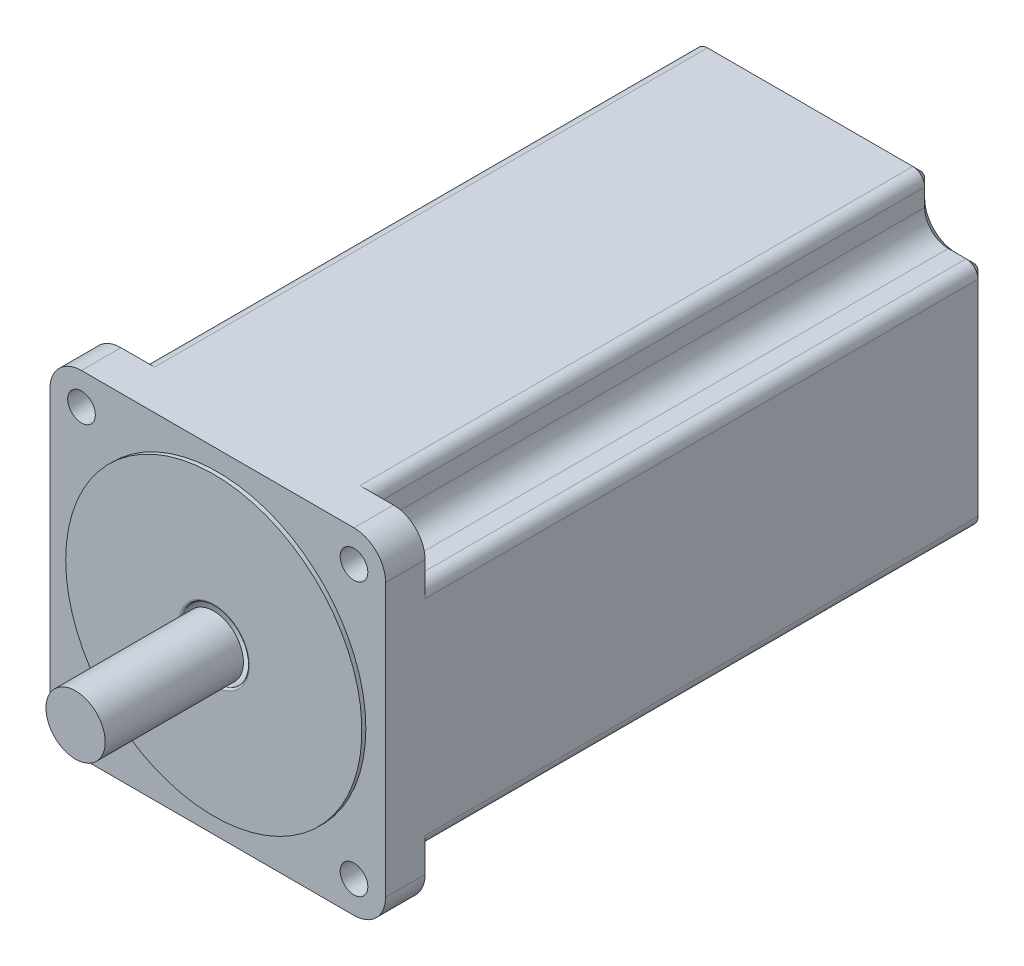
from build123d import *

# Parameters (mm, degrees)
SKETCH1_W                      = 152
SKETCH1_H                      = 85
BOSS_EXTRUDE1_DEPTH            = 85
SKETCH2_W                      = 13.5
SKETCH2_H                      = 13.5
CUT_EXTRUDE1_DEPTH             = 142
SKETCH3_W                      = 13.5
SKETCH3_H                      = 13.5
CUT_EXTRUDE2_DEPTH             = 142
SKETCH4_W                      = 13.5
SKETCH4_H                      = 13.5
CUT_EXTRUDE3_DEPTH             = 142
SKETCH5_W                      = 13.5
SKETCH5_H                      = 13.5
CUT_EXTRUDE4_DEPTH             = 142
SKETCH6_W                      = 37.5
SKETCH6_H                      = 1
F_7_0_7_DIAMETER_HOLE1_D       = 7
F_7_0_7_DIAMETER_HOLE1_DEPTH   = 152
F_17_0_17_DIAMETER_HOLE1_D     = 17
F_17_0_17_DIAMETER_HOLE1_DEPTH = 140
FILLET1_R                      = 3
FILLET2_R                      = 6
CHAMFER1_SIZE                  = 2
FILLET3_R                      = 0.5
FILLET4_R                      = 8
SKETCH11_R                     = 7.5
BOSS_EXTRUDE2_DEPTH            = 35


with BuildPart() as part:
    # Sketch1 → Boss-Extrude1 (new body)
    with BuildSketch(Plane(origin=(42.5, 0, 0), x_dir=(0, 0, -1), z_dir=(1, 0, 0))):
        with Locations((-76, 0)):
            Rectangle(SKETCH1_W, SKETCH1_H)
    extrude(amount=-BOSS_EXTRUDE1_DEPTH)

    # Sketch2 → Cut-Extrude1 (cut)
    with BuildSketch(Plane(origin=(0, 0, 0), x_dir=(-1, 0, 0), z_dir=(0, 0, -1))):
        with Locations((-35.75, -35.75)):
            Rectangle(SKETCH2_W, SKETCH2_H)
    extrude(amount=-CUT_EXTRUDE1_DEPTH, mode=Mode.SUBTRACT)

    # Sketch3 → Cut-Extrude2 (cut)
    with BuildSketch(Plane(origin=(0, 0, 0), x_dir=(-1, 0, 0), z_dir=(0, 0, -1))):
        with Locations((35.75, -35.75)):
            Rectangle(SKETCH3_W, SKETCH3_H)
    extrude(amount=-CUT_EXTRUDE2_DEPTH, mode=Mode.SUBTRACT)

    # Sketch4 → Cut-Extrude3 (cut)
    with BuildSketch(Plane(origin=(0, 0, 0), x_dir=(-1, 0, 0), z_dir=(0, 0, -1))):
        with Locations((-35.75, 35.75)):
            Rectangle(SKETCH4_W, SKETCH4_H)
    extrude(amount=-CUT_EXTRUDE3_DEPTH, mode=Mode.SUBTRACT)

    # Sketch5 → Cut-Extrude4 (cut)
    with BuildSketch(Plane(origin=(0, 0, 0), x_dir=(-1, 0, 0), z_dir=(0, 0, -1))):
        with Locations((35.75, 35.75)):
            Rectangle(SKETCH5_W, SKETCH5_H)
    extrude(amount=-CUT_EXTRUDE4_DEPTH, mode=Mode.SUBTRACT)

    # Sketch6 → Revolve1 (revolve)
    with BuildSketch(Plane.XZ):
        with Locations((18.75, 152.5)):
            Rectangle(SKETCH6_W, SKETCH6_H)
    revolve(axis=Axis((0, 0, 153), (0, 0, -1)))

    # Ø7.0 (7) Diameter Hole1
    with Locations(Plane.XY.offset(152)):
        with Locations((34.5, 34.5), (34.5, -34.5), (-34.5, -34.5), (-34.5, 34.5)):
            Hole(F_7_0_7_DIAMETER_HOLE1_D / 2, depth=F_7_0_7_DIAMETER_HOLE1_DEPTH)

    # Ø17.0 (17) Diameter Hole1
    with Locations(Plane.XY.offset(153)):
        with Locations((0, 0)):
            Hole(F_17_0_17_DIAMETER_HOLE1_D / 2, depth=F_17_0_17_DIAMETER_HOLE1_DEPTH)

    # Fillet1
    fillet1_edges = [part.edges().sort_by_distance(p)[0] for p in [
        (-42.5, 29, 71),
        (42.5, -29, 71),
        (-29, 42.5, 71),
        (42.5, 29, 71),
        (29, -42.5, 71),
        (-29, -42.5, 71),
        (-42.5, -29, 71),
        (29, 42.5, 71),
    ]]
    fillet(fillet1_edges, radius=FILLET1_R)

    # Fillet2
    fillet2_edges = [part.edges().sort_by_distance(p)[0] for p in [
        (-29, 29, 71),
        (-29, -29, 71),
        (29, -29, 71),
        (29, 29, 71),
    ]]
    fillet(fillet2_edges, radius=FILLET2_R)

    # Chamfer1
    chamfer1_edges = [part.edges().sort_by_distance(p)[0] for p in [
        (-30.757359313, -30.757359313, 0),
        (-29, -37.25, 0),
        (-37.25, -29, 0),
        (-28.121320344, -41.621320344, 0),
        (-41.621320344, -28.121320344, 0),
        (0, -42.5, 0),
        (-42.5, 0, 0),
        (28.121320344, -41.621320344, 0),
        (-41.621320344, 28.121320344, 0),
        (29, -37.25, 0),
        (-37.25, 29, 0),
        (30.757359313, -30.757359313, 0),
        (-30.757359313, 30.757359313, 0),
        (37.25, -29, 0),
        (-29, 37.25, 0),
        (41.621320344, -28.121320344, 0),
        (-28.121320344, 41.621320344, 0),
        (42.5, 0, 0),
        (0, 42.5, 0),
        (41.621320344, 28.121320344, 0),
        (28.121320344, 41.621320344, 0),
        (37.25, 29, 0),
        (29, 37.25, 0),
        (30.757359313, 30.757359313, 0),
    ]]
    chamfer(chamfer1_edges, length=CHAMFER1_SIZE)

    # Fillet3
    fillet3_edges = [part.edges().sort_by_distance(p)[0] for p in [
        (8.5, 0, 153),
    ]]
    fillet(fillet3_edges, radius=FILLET3_R)

    # Fillet4
    fillet4_edges = [part.edges().sort_by_distance(p)[0] for p in [
        (-42.5, -42.5, 147),
        (42.5, -42.5, 147),
        (-42.5, 42.5, 147),
        (42.5, 42.5, 147),
    ]]
    fillet(fillet4_edges, radius=FILLET4_R)


with BuildPart() as body_2:
    # Sketch11 → Boss-Extrude2 (new body)
    with BuildSketch(Plane.XY.offset(153)):
        Circle(SKETCH11_R)
    extrude(amount=BOSS_EXTRUDE2_DEPTH)


solid = Compound([part.part, body_2.part])
